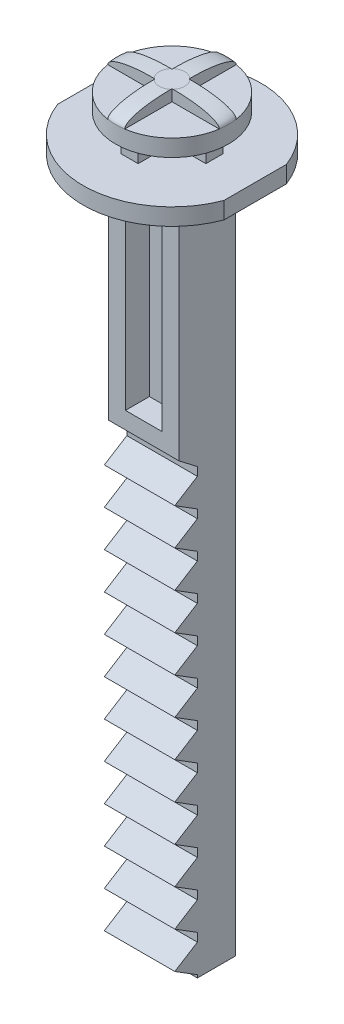
from build123d import *

# Parameters (mm, degrees)
SKETCH1_R           = 6.3
BOSS_EXTRUDE1_DEPTH = 1.2
SKETCH2_W           = 1.2
SKETCH2_H           = 6
SKETCH2_W_2         = 6
SKETCH2_H_2         = 1.2
BOSS_EXTRUDE2_DEPTH = 1.4
SKETCH3_R           = 4
BOSS_EXTRUDE3_DEPTH = 1.2
SKETCH4_W           = 1.2
SKETCH4_H           = 1.2
BOSS_EXTRUDE4_DEPTH = 0.8
FILLET1_SIZE        = 0.8
FILLET1_SIZE_2      = 3.1
SKETCH5_W           = 1
SKETCH5_H           = 11.8
CUT_EXTRUDE1_DEPTH  = 1.2
SKETCH6_W           = 5
SKETCH6_H           = 4
BOSS_EXTRUDE5_DEPTH = 49
SKETCH7_W           = 2.6
SKETCH7_H           = 15.4
CUT_EXTRUDE2_DEPTH  = 1.7
SKETCH8_W           = 2.6
SKETCH8_H           = 12.6
SKETCH8_H_2         = 35.2
CUT_EXTRUDE3_DEPTH  = 1.2
BOSS_EXTRUDE6_DEPTH = 1.2
SKETCH13_W          = 5
SKETCH13_H          = 32.4
CUT_EXTRUDE4_DEPTH  = 1.3
BOSS_EXTRUDE7_DEPTH = 5


with BuildPart() as part:
    # Sketch1 → Boss-Extrude1 (new body)
    with BuildSketch(Plane(origin=(0, 0, 0), x_dir=(1, 0, 0), z_dir=(0, 1, 0))):
        with Locations(Location((0, 0, 0), (0, 0, 270))):
            Circle(SKETCH1_R)
    extrude(amount=BOSS_EXTRUDE1_DEPTH)

    # Sketch2 → Boss-Extrude2 (add)
    with BuildSketch(Plane(origin=(0, 1.2, 0), x_dir=(1, 0, 0), z_dir=(0, 1, 0))):
        Rectangle(SKETCH2_W, SKETCH2_H)
        Rectangle(SKETCH2_W_2, SKETCH2_H_2)
    extrude(amount=BOSS_EXTRUDE2_DEPTH)

    # Sketch3 → Boss-Extrude3 (add)
    with BuildSketch(Plane(origin=(0, 2.6, 0), x_dir=(1, 0, 0), z_dir=(0, 1, 0))):
        with Locations(Location((0, 0, 0), (0, 0, 270))):
            Circle(SKETCH3_R)
    extrude(amount=BOSS_EXTRUDE3_DEPTH)

    # Sketch4 → Boss-Extrude4 (add)
    with BuildSketch(Plane(origin=(0, 3.8, 0), x_dir=(1, 0, 0), z_dir=(0, 1, 0))):
        with BuildLine():
            Line((0.6, 0.6), (0.6, -0.6))
            Line((0.6, -0.6), (3.954743987, -0.6))
            ThreePointArc((3.954743987, -0.6), (3.98866995, -0.300852167), (4, 0))
            ThreePointArc((4, 0), (3.98866995, 0.300852167), (3.954743987, 0.6))
            Line((3.954743987, 0.6), (0.6, 0.6))
        make_face()
        Rectangle(SKETCH4_W, SKETCH4_H)
        with BuildLine():
            ThreePointArc((-0.6, -3.954743987), (-0.300852167, -3.98866995), (0, -4))
            ThreePointArc((0, -4), (0.300852167, -3.98866995), (0.6, -3.954743987))
            Line((0.6, -3.954743987), (0.6, -0.6))
            Line((0.6, -0.6), (-0.6, -0.6))
            Line((-0.6, -0.6), (-0.6, -3.954743987))
        make_face()
        with BuildLine():
            Line((-3.954743987, -0.6), (-0.6, -0.6))
            Line((-0.6, -0.6), (-0.6, 0.6))
            Line((-0.6, 0.6), (-3.954743987, 0.6))
            ThreePointArc((-3.954743987, 0.6), (-3.988669951, 0.300852164), (-4, -6e-09))
            ThreePointArc((-4, -6e-09), (-3.98866995, -0.300852171), (-3.954743987, -0.6))
        make_face()
        with BuildLine():
            Line((-0.6, 0.6), (0.6, 0.6))
            Line((0.6, 0.6), (0.6, 3.954743987))
            ThreePointArc((0.6, 3.954743987), (0.300852167, 3.98866995), (0, 4))
            ThreePointArc((0, 4), (-0.300852167, 3.98866995), (-0.6, 3.954743987))
            Line((-0.6, 3.954743987), (-0.6, 0.6))
        make_face()
    extrude(amount=BOSS_EXTRUDE4_DEPTH)

    # Fillet1
    # an asymmetric fillet: 3.1, 0.8 mm, written as the material it takes off along each edge
    with BuildSketch(Plane(origin=(0, 4.6, 0), x_dir=(0.8691573226500636, 0, -0.4945356897977876), z_dir=(-0.4945356897977876, 0, -0.8691573226500636))) as fillet1_piece_1:
        with BuildLine():
            Bezier((4, FILLET1_SIZE), (4, 0), (4 - FILLET1_SIZE_2, 0), weights=[1, 0.707106781, 1])
            Line((4 - FILLET1_SIZE_2, 0), (4, 0))
            Line((4, 0), (4, FILLET1_SIZE))
        make_face()
    revolve(axis=Axis((0, 4.6, 0), (0, -1, 0)), revolution_arc=239.278275716, mode=Mode.SUBTRACT)
    with BuildSketch(Plane(origin=(0, 4.6, 0), x_dir=(-0.8691573226500663, 0, 0.4945356897977827), z_dir=(0.4945356897977827, 0, 0.8691573226500663))) as fillet1_piece_2:
        with BuildLine():
            Bezier((4, FILLET1_SIZE), (4, 0), (4 - FILLET1_SIZE_2, 0), weights=[1, 0.707106781, 1])
            Line((4 - FILLET1_SIZE_2, 0), (4, 0))
            Line((4, 0), (4, FILLET1_SIZE))
        make_face()
    revolve(axis=Axis((0, 4.6, 0), (0, -1, 0)), revolution_arc=239.278275716, mode=Mode.SUBTRACT)
    with BuildSketch(Plane(origin=(0, 4.6, 0), x_dir=(0.49453568979780754, 0, 0.8691573226500521), z_dir=(0.8691573226500521, 0, -0.49453568979780754))) as fillet1_piece_3:
        with BuildLine():
            Bezier((4, FILLET1_SIZE), (4, 0), (4 - FILLET1_SIZE_2, 0), weights=[1, 0.707106781, 1])
            Line((4 - FILLET1_SIZE_2, 0), (4, 0))
            Line((4, 0), (4, FILLET1_SIZE))
        make_face()
    revolve(axis=Axis((0, 4.6, 0), (0, -1, 0)), revolution_arc=239.278275716, mode=Mode.SUBTRACT)
    with BuildSketch(Plane(origin=(0, 4.6, 0), x_dir=(-0.4945356897977526, 0, -0.8691573226500835), z_dir=(-0.8691573226500835, 0, 0.4945356897977526))) as fillet1_piece_4:
        with BuildLine():
            Bezier((4, FILLET1_SIZE), (4, 0), (4 - FILLET1_SIZE_2, 0), weights=[1, 0.707106781, 1])
            Line((4 - FILLET1_SIZE_2, 0), (4, 0))
            Line((4, 0), (4, FILLET1_SIZE))
        make_face()
    revolve(axis=Axis((0, 4.6, 0), (0, -1, 0)), revolution_arc=239.278275716, mode=Mode.SUBTRACT)

    # Sketch5 → Cut-Extrude1 (cut)
    with BuildSketch(Plane(origin=(0, 0, 0), x_dir=(-1, 0, 0), z_dir=(0, -1, 0))):
        with Locations((6.4, 0)):
            Rectangle(SKETCH5_W, SKETCH5_H)
        with Locations((-6.4, 0)):
            Rectangle(SKETCH5_W, SKETCH5_H)
    extrude(amount=-CUT_EXTRUDE1_DEPTH, mode=Mode.SUBTRACT)

    # Sketch6 → Boss-Extrude5 (add)
    with BuildSketch(Plane(origin=(0, 0, 0), x_dir=(-1, 0, 0), z_dir=(0, -1, 0))):
        Rectangle(SKETCH6_W, SKETCH6_H)
    extrude(amount=BOSS_EXTRUDE5_DEPTH)

    # Sketch7 → Cut-Extrude2 (cut)
    with BuildSketch(Plane.XY.offset(2)):
        with Locations((0, -7.7)):
            Rectangle(SKETCH7_W, SKETCH7_H)
    extrude(amount=-CUT_EXTRUDE2_DEPTH, mode=Mode.SUBTRACT)

    # Sketch8 → Cut-Extrude3 (cut)
    with BuildSketch(Plane(origin=(0, 0, -2), x_dir=(-1, 0, 0), z_dir=(0, 0, -1))):
        with Locations((0, -6.3)):
            Rectangle(SKETCH8_W, SKETCH8_H)
        with Locations((0, -31.4)):
            Rectangle(SKETCH8_W, SKETCH8_H_2)
    extrude(amount=-CUT_EXTRUDE3_DEPTH, mode=Mode.SUBTRACT)

    # Sketch12 → Boss-Extrude6 (add)
    with BuildSketch(Plane(origin=(0, -12.6, 0), x_dir=(1, 0, 0), z_dir=(0, 1, 0))):
        with BuildLine():
            Line((-1.3, 2), (-2.5, 2))
            ThreePointArc((-2.5, 2), (0, 2.8), (2.5, 2))
            Line((2.5, 2), (1.3, 2))
            Line((1.3, 2), (1.3, 0.8))
            Line((1.3, 0.8), (-1.3, 0.8))
            Line((-1.3, 0.8), (-1.3, 2))
        make_face()
    extrude(amount=-BOSS_EXTRUDE6_DEPTH)

    # Sketch13 → Cut-Extrude4 (cut)
    with BuildSketch(Plane.XY.offset(2)):
        with Locations((0, -32.8)):
            Rectangle(SKETCH13_W, SKETCH13_H)
    extrude(amount=-CUT_EXTRUDE4_DEPTH, mode=Mode.SUBTRACT)

    # Sketch14 → Boss-Extrude7 (add)
    with BuildSketch(Plane(origin=(2.5, 0, 0), x_dir=(0, 0, -1), z_dir=(1, 0, 0))):
        Polygon((-0.7, -46.8), (-0.7, -48.8), (-2.3, -47.8), align=None)
        Polygon((-2.3, -45.2), (-0.7, -44.2), (-0.7, -46.2), align=None)
        Polygon((-2.3, -42.6), (-0.7, -41.6), (-0.7, -43.6), align=None)
        Polygon((-2.3, -40), (-0.7, -39), (-0.7, -41), align=None)
        Polygon((-2.3, -37.4), (-0.7, -36.4), (-0.7, -38.4), align=None)
        Polygon((-2.3, -34.8), (-0.7, -33.8), (-0.7, -35.8), align=None)
        Polygon((-2.3, -32.2), (-0.7, -31.2), (-0.7, -33.2), align=None)
        Polygon((-2.3, -29.6), (-0.7, -28.6), (-0.7, -30.6), align=None)
        Polygon((-2.3, -27), (-0.7, -26), (-0.7, -28), align=None)
        Polygon((-2.3, -24.4), (-0.7, -23.4), (-0.7, -25.4), align=None)
        Polygon((-2.3, -21.8), (-0.7, -20.8), (-0.7, -22.8), align=None)
        Polygon((-2.3, -19.2), (-0.7, -18.2), (-0.7, -20.2), align=None)
        Polygon((-0.7, -17.6), (-2, -16.6), (-0.7, -16.6), align=None)
    extrude(amount=-BOSS_EXTRUDE7_DEPTH)


solid = part.part
